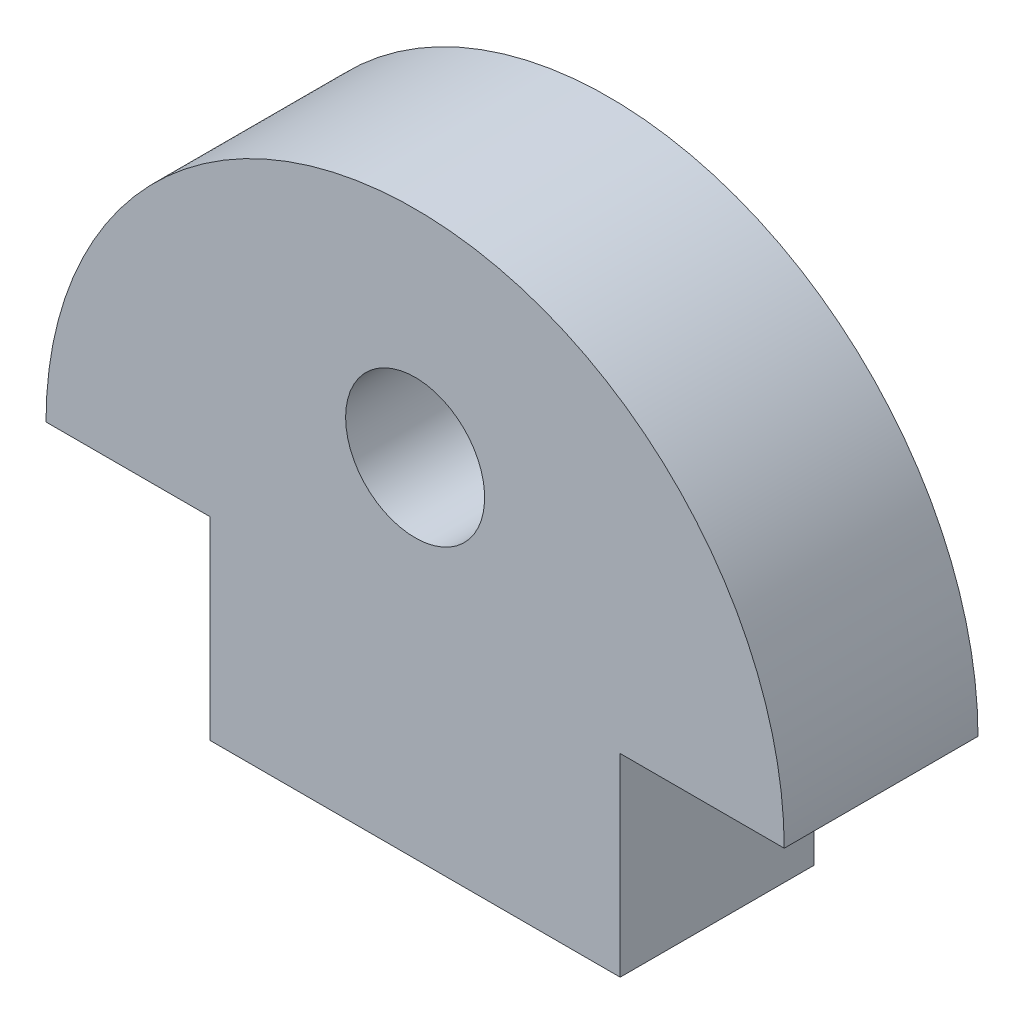
from build123d import *

# Parameters (mm, degrees)
BASE_DEPTH          = 5.999988
AXLE_HOLE_D         = 4.3053
SKETCH8_W           = 12.7
SKETCH8_H           = 5.999988
BOSS_EXTRUDE2_DEPTH = 5.999988


with BuildPart() as part:
    # Sketch1 → Base (new body)
    with BuildSketch(Plane.XY):
        with BuildLine():
            Line((-11.43, -12.7), (11.43, -12.7))
            ThreePointArc((11.43, -12.7), (0, -1.27), (-11.43, -12.7))
        make_face()
    extrude(amount=BASE_DEPTH)

    # Axle hole (through all)
    with Locations(Plane(origin=(0, 0, 0), x_dir=(-1, 0, 0), z_dir=(0, 0, -1))):
        with Locations((0, -7.9375)):
            Hole(AXLE_HOLE_D / 2)

    # Sketch8 → Boss-Extrude2 (add)
    with BuildSketch(Plane.XY.offset(5.999988)):
        with Locations((0, -15.699994)):
            Rectangle(SKETCH8_W, SKETCH8_H)
    extrude(amount=-BOSS_EXTRUDE2_DEPTH)


solid = part.part
